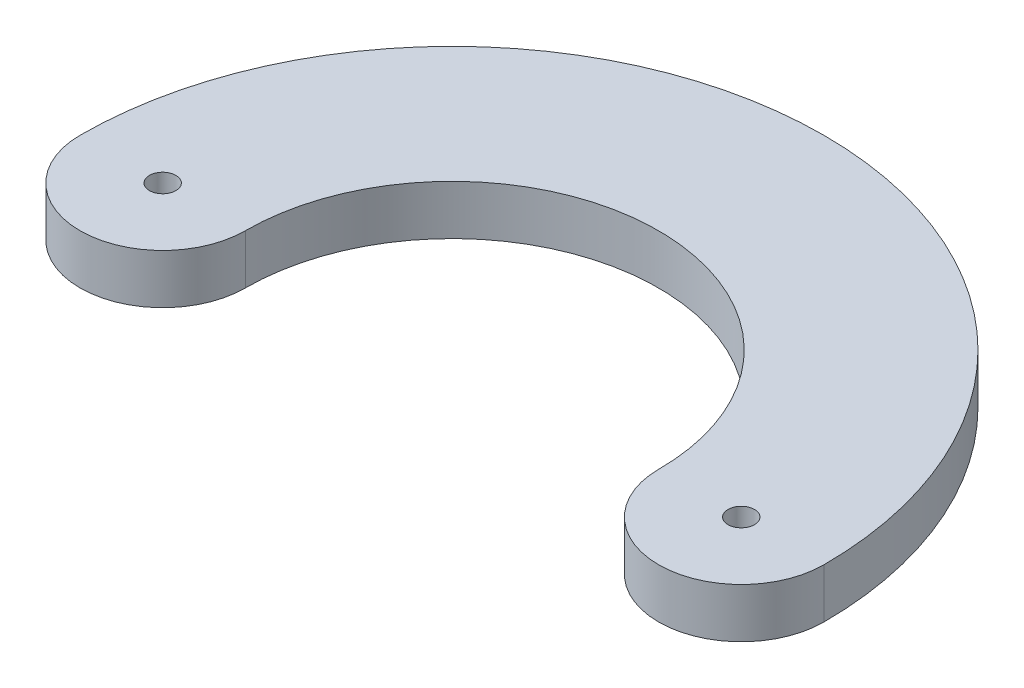
from build123d import *

# Parameters (mm, degrees)
SKETCH1_R           = 1.6
BOSS_EXTRUDE1_DEPTH = 6


with BuildPart() as part:
    # Sketch1 → Boss-Extrude1 (new body)
    with BuildSketch(Plane(origin=(0, 0, 0), x_dir=(1, 0, 0), z_dir=(0, 1, 0))):
        with BuildLine():
            ThreePointArc((25, 0), (0, 25), (-25, 0))
            ThreePointArc((-25, 0), (-35, -10), (-45, 0))
            ThreePointArc((-45, 0), (0, 45), (45, 0))
            ThreePointArc((45, 0), (35, -10), (25, 0))
        make_face()
        with Locations((-35, 0)):
            Circle(SKETCH1_R, mode=Mode.SUBTRACT)
        with Locations((35, 0)):
            Circle(SKETCH1_R, mode=Mode.SUBTRACT)
    extrude(amount=BOSS_EXTRUDE1_DEPTH)


solid = part.part
